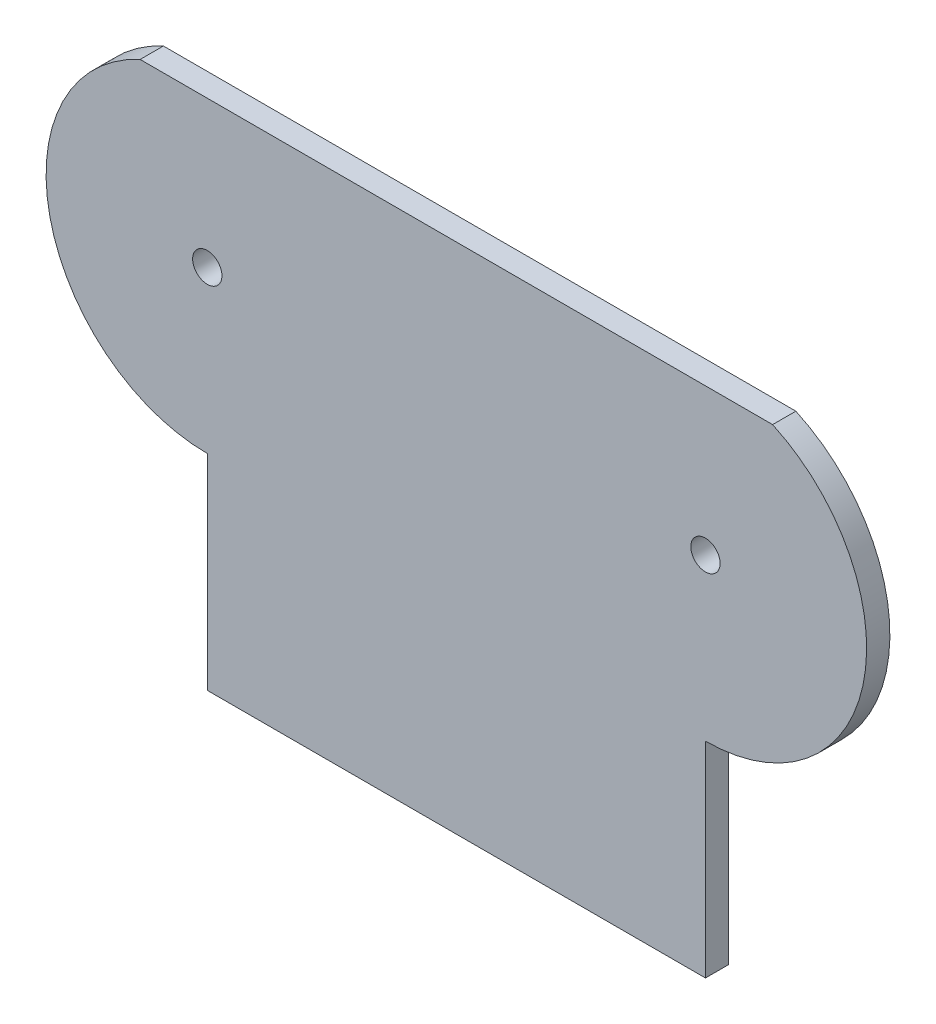
from build123d import *

# Parameters (mm, degrees)
SKETCH1_R           = 2
BOSS_EXTRUDE1_DEPTH = 3.175


with BuildPart() as part:
    # Sketch1 → Boss-Extrude1 (new body)
    with BuildSketch(Plane.XY):
        with BuildLine():
            Line((56, 0), (124, 0))
            Line((124, 0), (124, 28))
            ThreePointArc((124, 28), (145.49418526, 45.30958424), (133.16515139, 70))
            Line((133.16515139, 70), (46.83484861, 70))
            ThreePointArc((46.83484861, 70), (34.50581474, 45.30958424), (56, 28))
            Line((56, 28), (56, 0))
        make_face()
        with Locations((56, 50)):
            Circle(SKETCH1_R, mode=Mode.SUBTRACT)
        with Locations((124, 50)):
            Circle(SKETCH1_R, mode=Mode.SUBTRACT)
    extrude(amount=BOSS_EXTRUDE1_DEPTH)


solid = part.part
